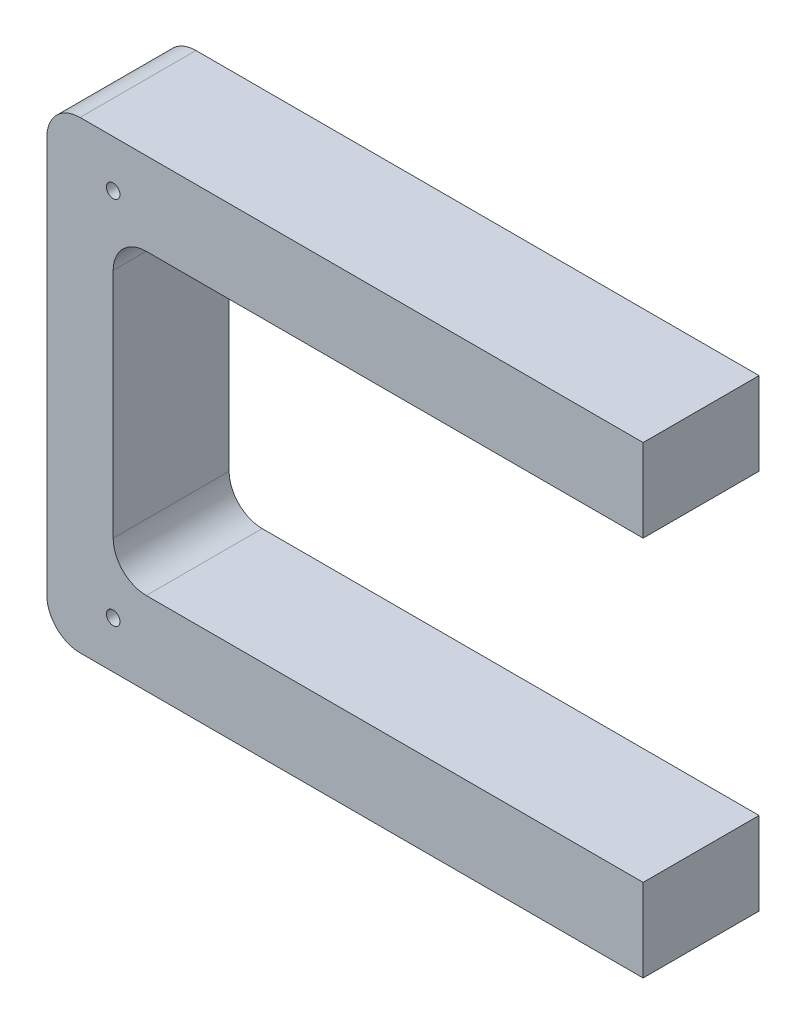
from build123d import *

# Parameters (mm, degrees)
SKETCH_1_R      = 2.05
EXTRUDE_2_DEPTH = 35
FILLET_2_R      = 10


with BuildPart() as part:
    # 草图1 → 凸台-拉伸2 (new body)
    with BuildSketch(Plane.XY):
        Polygon((0, 0), (180, 0), (180, 25), (20, 25), (20, 115), (180, 115), (180, 140), (0, 140), align=None)
        with Locations((20, 14.1645)):
            Circle(SKETCH_1_R, mode=Mode.SUBTRACT)
        with Locations((20, 125.8355)):
            Circle(SKETCH_1_R, mode=Mode.SUBTRACT)
    extrude(amount=EXTRUDE_2_DEPTH)

    # 圆角2
    fillet_2_edges = [part.edges().sort_by_distance(p)[0] for p in [
        (0, 0, 17.5),
        (0, 140, 17.5),
        (20, 25, 17.5),
        (20, 115, 17.5),
    ]]
    fillet(fillet_2_edges, radius=FILLET_2_R)


solid = part.part
